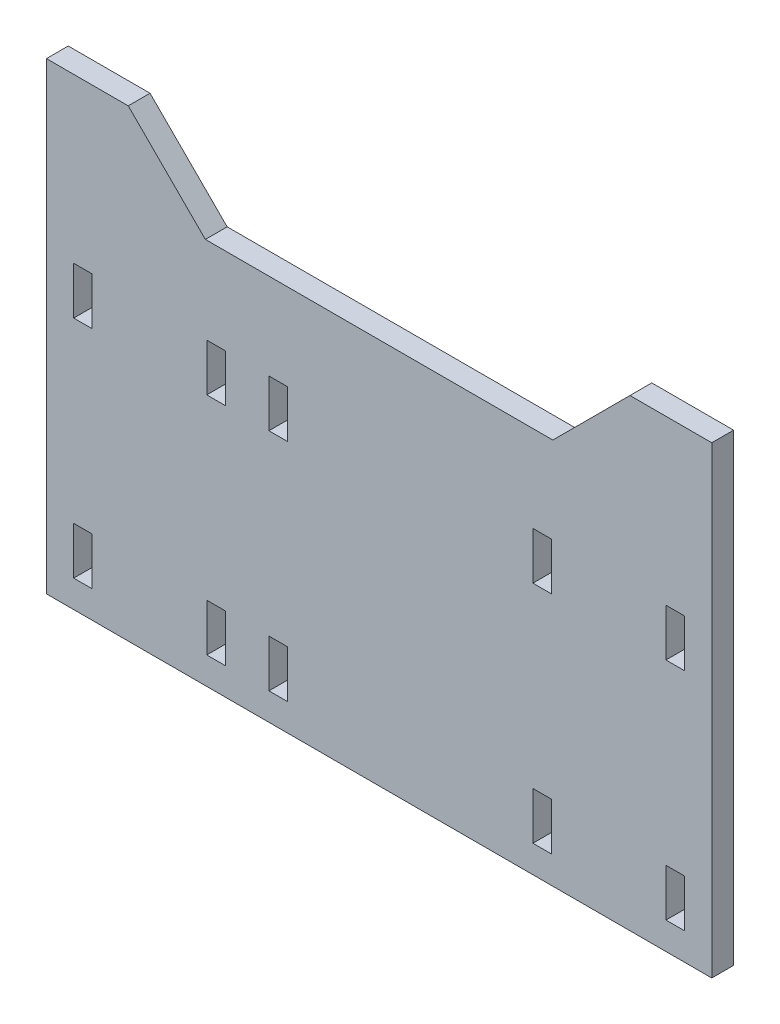
from build123d import *

# Parameters (mm, degrees)
SKETCH1_W           = 122
SKETCH1_H           = 60
SKETCH1_W_2         = 3.4
SKETCH1_H_2         = 8.7
BOSS_EXTRUDE1_DEPTH = 4
BOSS_EXTRUDE2_DEPTH = 4


with BuildPart() as part:
    # Sketch1 → Boss-Extrude1 (new body)
    with BuildSketch(Plane.XY):
        with Locations((-5.7, 0)):
            Rectangle(SKETCH1_W, SKETCH1_H)
        with Locations((-35.6, 20.65)):
            Rectangle(SKETCH1_W_2, SKETCH1_H_2, mode=Mode.SUBTRACT)
        with Locations((24.2, 20.65)):
            Rectangle(SKETCH1_W_2, SKETCH1_H_2, mode=Mode.SUBTRACT)
        with Locations((24.2, -20.65)):
            Rectangle(SKETCH1_W_2, SKETCH1_H_2, mode=Mode.SUBTRACT)
        with Locations((-24.2, 20.65)):
            Rectangle(SKETCH1_W_2, SKETCH1_H_2, mode=Mode.SUBTRACT)
        with Locations((-24.2, -20.65)):
            Rectangle(SKETCH1_W_2, SKETCH1_H_2, mode=Mode.SUBTRACT)
        with Locations((48.6, 20.65)):
            Rectangle(SKETCH1_W_2, SKETCH1_H_2, mode=Mode.SUBTRACT)
        with Locations((48.6, -20.65)):
            Rectangle(SKETCH1_W_2, SKETCH1_H_2, mode=Mode.SUBTRACT)
        with Locations((-35.6, -20.65)):
            Rectangle(SKETCH1_W_2, SKETCH1_H_2, mode=Mode.SUBTRACT)
        with Locations((-60, 20.65)):
            Rectangle(SKETCH1_W_2, SKETCH1_H_2, mode=Mode.SUBTRACT)
        with Locations((-60, -20.65)):
            Rectangle(SKETCH1_W_2, SKETCH1_H_2, mode=Mode.SUBTRACT)
    extrude(amount=BOSS_EXTRUDE1_DEPTH)

    # Sketch2 → Boss-Extrude2 (add)
    with BuildSketch(Plane.XY):
        Polygon((-66.7, 30), (-66.7, 55), (-51.7, 55), (-37.557864376, 40.857864376), (26.157864376, 40.857864376), (40.3, 55), (55.3, 55), (55.3, 30), align=None)
    extrude(amount=BOSS_EXTRUDE2_DEPTH)


solid = part.part
